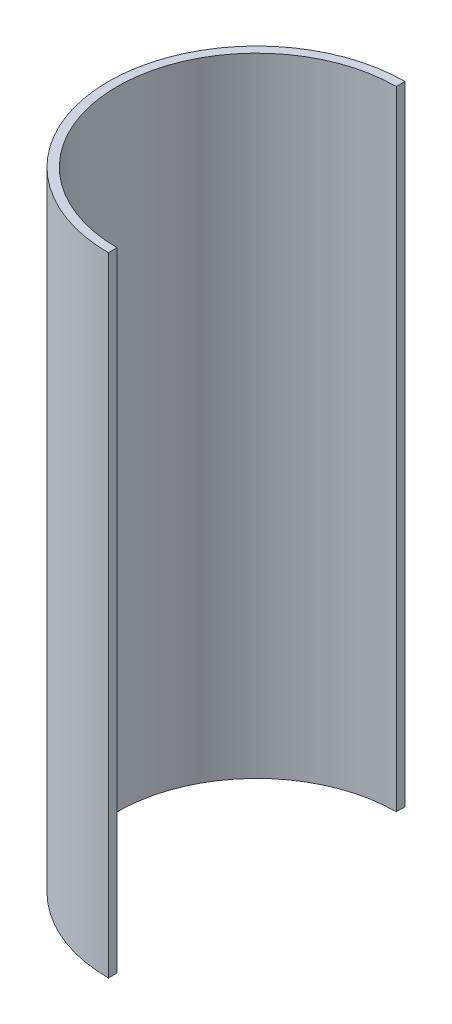
from build123d import *

# Parameters (mm, degrees)
BOSS_EXTRUDE1_DEPTH = 457.2


with BuildPart() as part:
    # Sketch1 → Boss-Extrude1 (new body)
    with BuildSketch(Plane(origin=(0, 0, 0), x_dir=(1, 0, 0), z_dir=(0, 1, 0))):
        with BuildLine():
            Line((0, 107.95), (0, 101.6))
            ThreePointArc((0, 101.6), (-101.6, 0), (0, -101.6))
            Line((0, -101.6), (0, -107.95))
            ThreePointArc((0, -107.95), (-107.95, 0), (0, 107.95))
        make_face()
    extrude(amount=BOSS_EXTRUDE1_DEPTH)


solid = part.part
